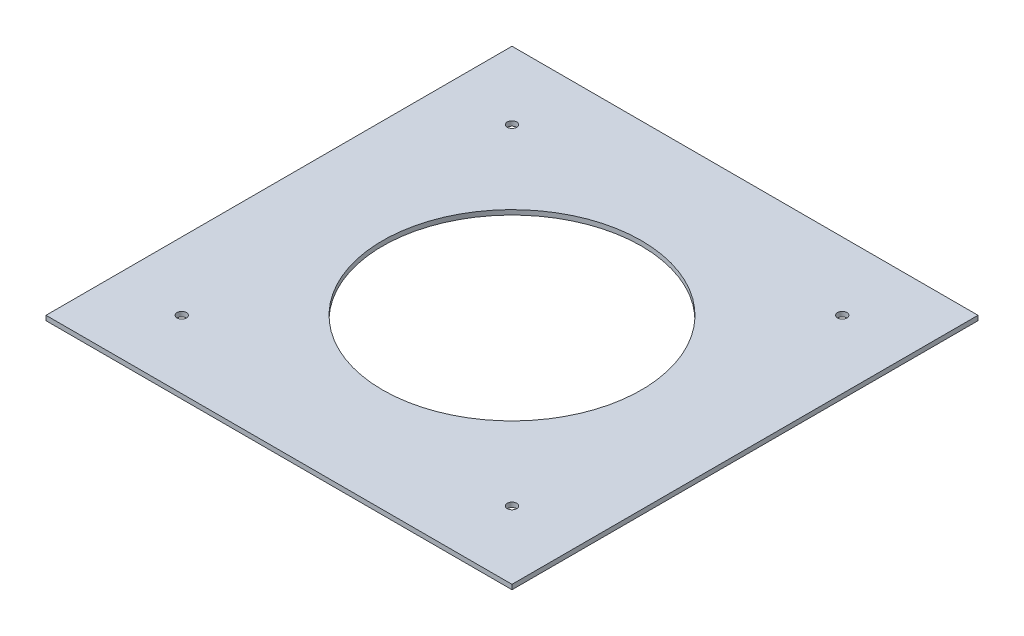
from build123d import *

# Parameters (mm, degrees)
SKETCH1_W           = 98.782817332
SKETCH1_H           = 98.782817332
BOSS_EXTRUDE1_DEPTH = 1.000000032
SKETCH3_R           = 0.999998
CUT_EXTRUDE2_DEPTH  = 70.85715783
SKETCH8_R           = 27.432
CUT_EXTRUDE9_DEPTH  = 70.85715783


with BuildPart() as part:
    # Sketch1 → Boss-Extrude1 (new body)
    with BuildSketch(Plane(origin=(0, 0, 0), x_dir=(1, 0, 0), z_dir=(0, 1, 0))):
        Rectangle(SKETCH1_W, SKETCH1_H)
    extrude(amount=BOSS_EXTRUDE1_DEPTH)

    # Sketch3 → Cut-Extrude2 (cut, through all)
    with BuildSketch(Plane(origin=(0, 0, 0), x_dir=(1, 0, 0), z_dir=(0, 1, 0))):
        with Locations((35.001787507, 35.001787507)):
            Circle(SKETCH3_R)
        with Locations((35.001787507, -35.001787507)):
            Circle(SKETCH3_R)
        with Locations((-35.001787507, -35.001787507)):
            Circle(SKETCH3_R)
        with Locations((-35.001787507, 35.001787507)):
            Circle(SKETCH3_R)
    extrude(amount=CUT_EXTRUDE2_DEPTH, mode=Mode.SUBTRACT)

    # Sketch8 → Cut-Extrude9 (cut, through all)
    with BuildSketch(Plane(origin=(0, 0, 0), x_dir=(1, 0, 0), z_dir=(0, 1, 0))):
        Circle(SKETCH8_R)
    extrude(amount=CUT_EXTRUDE9_DEPTH, mode=Mode.SUBTRACT)


solid = part.part
